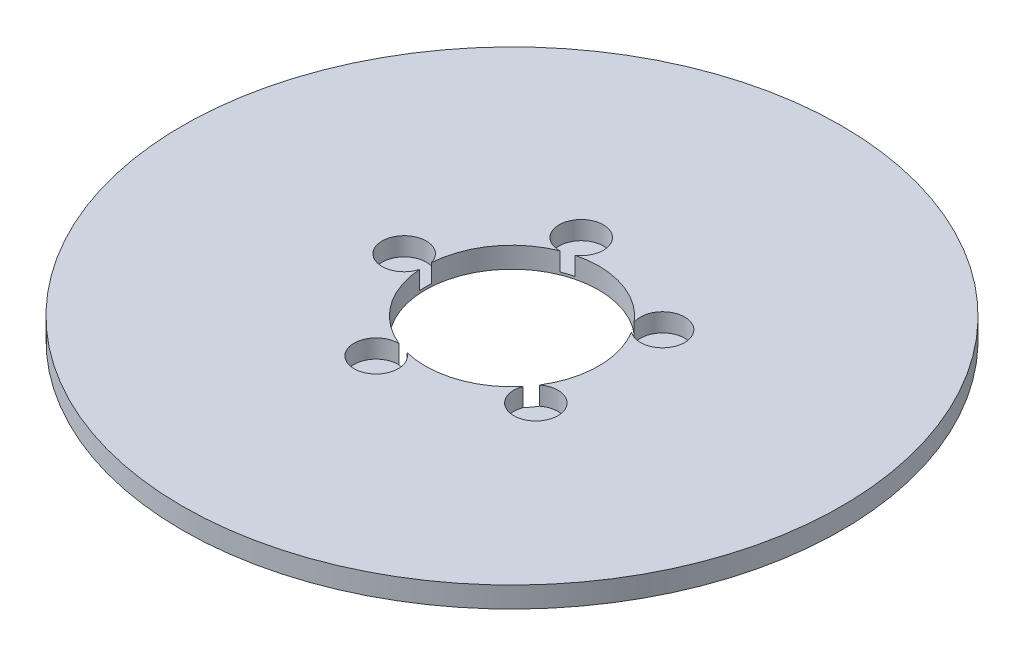
from build123d import *

# Parameters (mm, degrees)
SKETCH1_R           = 95
BOSS_EXTRUDE1_DEPTH = 6
SKETCH2_R           = 25
CUT_EXTRUDE1_DEPTH  = 135.484199815
SKETCH3_R           = 6.377477408
CUT_EXTRUDE2_DEPTH  = 5.29616068
CIRPATTERN1_COUNT   = 5


with BuildPart() as part:
    # Sketch1 → Boss-Extrude1 (new body)
    with BuildSketch(Plane(origin=(0, 0, 0), x_dir=(1, 0, 0), z_dir=(0, 1, 0))):
        Circle(SKETCH1_R)
    extrude(amount=BOSS_EXTRUDE1_DEPTH)

    # Sketch2 → Cut-Extrude1 (cut, through all)
    with BuildSketch(Plane(origin=(0, 0, 0), x_dir=(1, 0, 0), z_dir=(0, 1, 0))):
        Circle(SKETCH2_R)
    extrude(amount=CUT_EXTRUDE1_DEPTH, mode=Mode.SUBTRACT)

    # Sketch3 → Cut-Extrude2 (cut)
    with BuildSketch(Plane(origin=(0, 6, 0), x_dir=(1, 0, 0), z_dir=(0, 1, 0))):
        with Locations((-31.080763127, 0)):
            Circle(SKETCH3_R)
    cut_extrude2 = extrude(amount=-CUT_EXTRUDE2_DEPTH, mode=Mode.SUBTRACT)

    # CirPattern1: Cut-Extrude2 ×5 about axis
    cirpattern1_axis = Axis((0, 0, 0), (0, 1, 0))
    for i in range(1, CIRPATTERN1_COUNT):
        add(cut_extrude2.rotate(cirpattern1_axis, i * 360 / CIRPATTERN1_COUNT), mode=Mode.SUBTRACT)


solid = part.part
